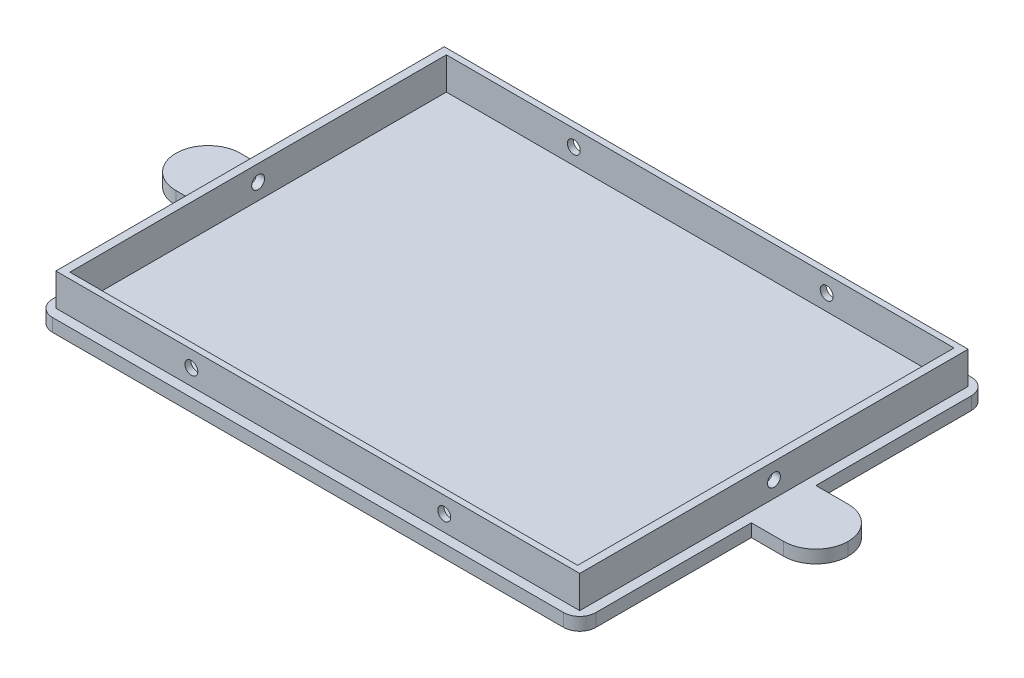
from build123d import *

# Parameters (mm, degrees)
BOSS_EXTRUDE1_DEPTH = 4
SKETCH2_W           = 162.38
SKETCH2_H           = 120.39
SKETCH2_W_2         = 157.38
SKETCH2_H_2         = 116.682954798
BOSS_EXTRUDE2_DEPTH = 10
FILLET1_R           = 10
FILLET2_R           = 5
SKETCH3_R           = 2
CUT_EXTRUDE1_DEPTH  = 182
SKETCH4_R           = 2
CUT_EXTRUDE2_DEPTH  = 182


with BuildPart() as part:
    # Sketch1 → Boss-Extrude1 (new body)
    with BuildSketch(Plane(origin=(0, 0, 0), x_dir=(1, 0, 0), z_dir=(0, 1, 0))):
        Polygon((-84.19, 63.195), (84.19, 63.195), (84.19, 10), (104.19, 10), (104.19, -10), (84.19, -10), (84.19, -63.195), (-84.19, -63.195), (-84.19, -10), (-104.19, -10), (-104.19, 10), (-84.19, 10), align=None)
    extrude(amount=BOSS_EXTRUDE1_DEPTH)

    # Sketch2 → Boss-Extrude2 (add)
    with BuildSketch(Plane(origin=(0, 4, 0), x_dir=(1, 0, 0), z_dir=(0, 1, 0))):
        Rectangle(SKETCH2_W, SKETCH2_H)
        Rectangle(SKETCH2_W_2, SKETCH2_H_2, mode=Mode.SUBTRACT)
    extrude(amount=BOSS_EXTRUDE2_DEPTH)

    # Fillet1
    fillet1_edges = [part.edges().sort_by_distance(p)[0] for p in [
        (104.19, 2, -10),
        (104.19, 2, 10),
        (-104.19, 2, -10),
        (-104.19, 2, 10),
    ]]
    fillet(fillet1_edges, radius=FILLET1_R - 0.0001)  # a hair under: the kernel refuses the full size

    # Fillet2
    fillet2_edges = [part.edges().sort_by_distance(p)[0] for p in [
        (84.19, 2, 63.195),
        (-84.19, 2, 63.195),
        (-84.19, 2, -63.195),
        (84.19, 2, -63.195),
    ]]
    fillet(fillet2_edges, radius=FILLET2_R)

    # Sketch3 → Cut-Extrude1 (cut)
    with BuildSketch(Plane(origin=(81.19, 0, 0), x_dir=(0, 0, -1), z_dir=(1, 0, 0))):
        with Locations((0, 9)):
            Circle(SKETCH3_R)
    extrude(amount=-CUT_EXTRUDE1_DEPTH, mode=Mode.SUBTRACT)

    # Sketch4 → Cut-Extrude2 (cut)
    with BuildSketch(Plane(origin=(0, 0, -63.195), x_dir=(-1, 0, 0), z_dir=(0, 0, -1))):
        with Locations((39.19, 9)):
            Circle(SKETCH4_R)
        with Locations((-39.19, 9)):
            Circle(SKETCH4_R)
    extrude(amount=-CUT_EXTRUDE2_DEPTH, mode=Mode.SUBTRACT)


solid = part.part
